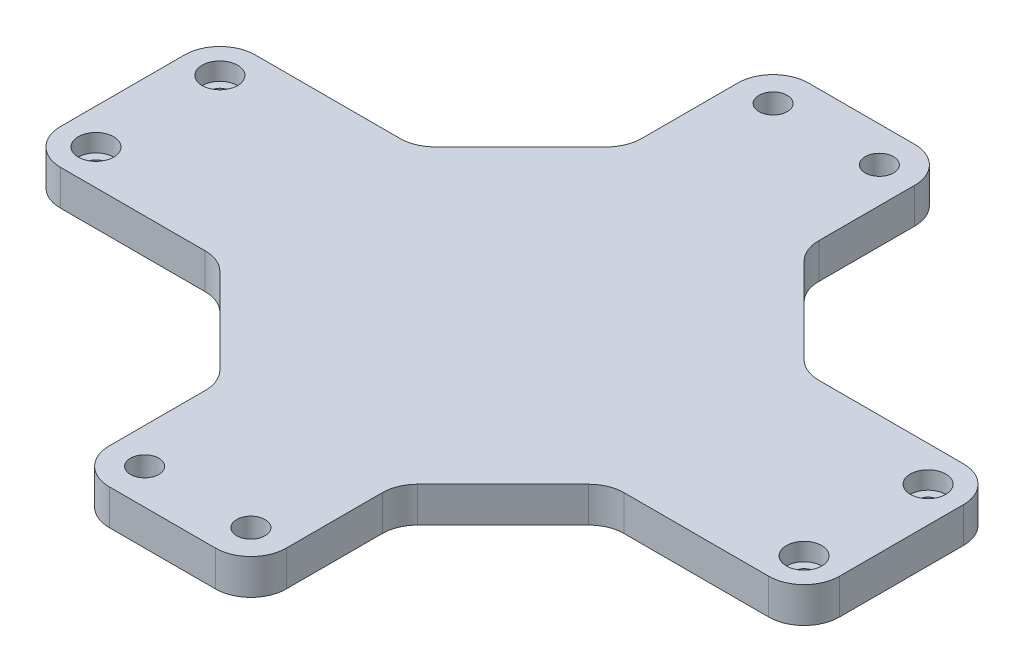
from build123d import *

# Parameters (mm, degrees)
SKETCH_2_R          = 1.05
SKETCH_2_R_2        = 1.6
EXTRUDE_1_DEPTH     = 4
SKETCH_3_R          = 2
CUT_EXTRUDE_1_DEPTH = 2
CHAMFER_1_SIZE      = 12
FILLET_1_R          = 4


with BuildPart() as part:
    # 草图2 → 凸台-拉伸1 (new body)
    with BuildSketch(Plane(origin=(0, 0, 0), x_dir=(1, 0, 0), z_dir=(0, 1, 0))):
        Polygon((20.25, -11), (54.25, -11), (54.25, 11), (20.25, 11), (20.25, 39.5), (0.25, 39.5), (0.25, 11), (-33.75, 11), (-33.75, -11), (0.25, -11), (0.25, -39.5), (20.25, -39.5), align=None)
        with Locations((-29.75, -7)):
            Circle(SKETCH_2_R, mode=Mode.SUBTRACT)
        with Locations((50.25, -7)):
            Circle(SKETCH_2_R, mode=Mode.SUBTRACT)
        with Locations((-29.75, 7)):
            Circle(SKETCH_2_R, mode=Mode.SUBTRACT)
        with Locations((50.25, 7)):
            Circle(SKETCH_2_R, mode=Mode.SUBTRACT)
        with Locations((16.25, -35.5)):
            Circle(SKETCH_2_R_2, mode=Mode.SUBTRACT)
        with Locations((4.25, -35.5)):
            Circle(SKETCH_2_R_2, mode=Mode.SUBTRACT)
        with Locations((16.25, 35.5)):
            Circle(SKETCH_2_R_2, mode=Mode.SUBTRACT)
        with Locations((4.25, 35.5)):
            Circle(SKETCH_2_R_2, mode=Mode.SUBTRACT)
    extrude(amount=EXTRUDE_1_DEPTH)

    # 草图3 → 切除-拉伸1 (cut)
    with BuildSketch(Plane(origin=(0, 4, 0), x_dir=(1, 0, 0), z_dir=(0, 1, 0))):
        with Locations((-29.75, 7)):
            Circle(SKETCH_3_R)
        with Locations((-29.75, -7)):
            Circle(SKETCH_3_R)
        with Locations((50.25, 7)):
            Circle(SKETCH_3_R)
        with Locations((50.25, -7)):
            Circle(SKETCH_3_R)
    extrude(amount=-CUT_EXTRUDE_1_DEPTH, mode=Mode.SUBTRACT)

    # 倒角1
    chamfer_1_edges = [part.edges().sort_by_distance(p)[0] for p in [
        (0.25, 2, 11),
        (20.25, 2, 11),
        (20.25, 2, -11),
        (0.25, 2, -11),
    ]]
    chamfer(chamfer_1_edges, length=CHAMFER_1_SIZE)

    # 圆角1
    fillet_1_edges = [part.edges().sort_by_distance(p)[0] for p in [
        (-33.75, 2, -11),
        (20.25, 2, -39.5),
        (54.25, 2, -11),
        (54.25, 2, 11),
        (20.25, 2, 39.5),
        (0.25, 2, 39.5),
        (-33.75, 2, 11),
        (0.25, 2, -39.5),
        (0.25, 2, 23),
        (20.25, 2, 23),
        (32.25, 2, 11),
        (32.25, 2, -11),
        (20.25, 2, -23),
        (0.25, 2, -23),
        (-11.75, 2, -11),
        (-11.75, 2, 11),
    ]]
    fillet(fillet_1_edges, radius=FILLET_1_R)


solid = part.part
